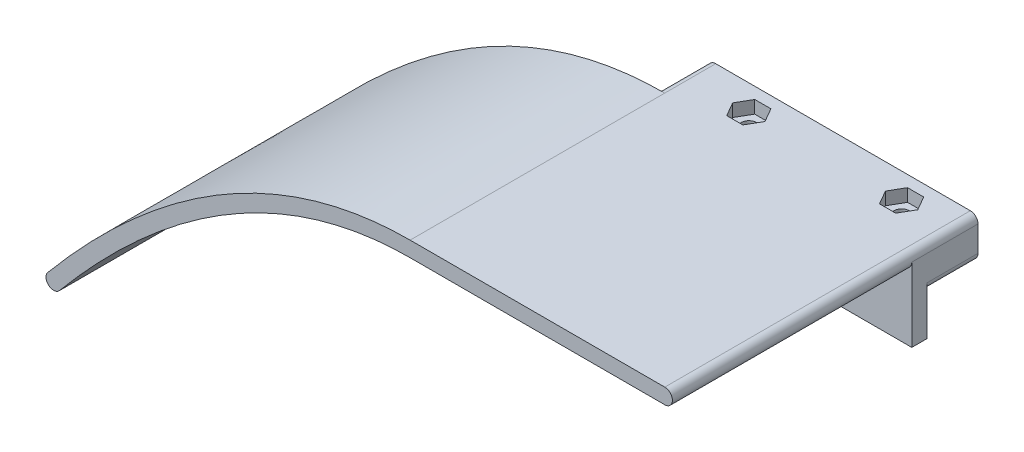
from build123d import *

# Parameters (mm, degrees)
EXTRUDE_1_DEPTH     = 50
EXTRUDE_2_DEPTH     = 3
EXTRUDE_START       = 10
EXTRUDE_3_DEPTH     = 10
SKETCH_4_R          = 1.5
CUT_EXTRUDE_1_DEPTH = 118.080033402
CUT_EXTRUDE_2_DEPTH = 117.530565712
CUT_EXTRUDE_START   = -2.5
CUT_EXTRUDE_3_DEPTH = 120.580033402
FILLET_1_R          = 2


with BuildPart() as part:
    # 草图1 → 凸台-拉伸1 (new body)
    with BuildSketch(Plane.XY):
        with BuildLine():
            Line((-25, -1.5), (25, -1.5))
            ThreePointArc((25, -1.5), (26.5, 0), (25, 1.5))
            Line((25, 1.5), (-25, 1.5))
            add(Edge.make_bspline(
                [(-25, 1.5), (-38.932541092, 1.484861592), (-61.458930533, -8.274990766), (-83.417009709, -24.344980195), (-96.150189782, -39.5743173)],
                knots=[0, 0, 0, 0.375, 0.625, 1, 1, 1], degree=2))
            ThreePointArc((-96.150189782, -39.5743173), (-95.96284135, -41.687348432), (-93.849810218, -41.5))
            add(Edge.make_bspline(
                [(-25, -1.5), (-60.365202195, -1.5), (-93.849810218, -41.5)],
                knots=[0, 0, 0, 1, 1, 1], degree=2))
        make_face()
    extrude(amount=EXTRUDE_1_DEPTH)

    # 草图2 → 凸台-拉伸2 (add)
    with BuildSketch(Plane(origin=(0, 0, 0), x_dir=(-1, 0, 0), z_dir=(0, 0, -1))):
        with BuildLine():
            Line((25, 1.5), (-25, 1.5))
            ThreePointArc((-25, 1.5), (-26.060660172, 1.060660172), (-26.5, 0))
            Line((-26.5, 0), (-26.5, -42.03715865))
            Line((-26.5, -42.03715865), (95, -42.03715865))
            ThreePointArc((95, -42.03715865), (96.359091981, -41.171878263), (96.150189782, -39.5743173))
            add(Edge.make_bspline(
                [(25, 1.5), (38.932541092, 1.484861592), (61.458930533, -8.274990766), (83.417009709, -24.344980195), (96.150189782, -39.5743173)],
                knots=[0, 0, 0, 0.375, 0.625, 1, 1, 1], degree=2))
        make_face()
    extrude(amount=-EXTRUDE_2_DEPTH)

    # 草图3 → 凸台-拉伸3 (add)
    with BuildSketch(Plane(origin=(0, 0, 0), x_dir=(-1, 0, 0), z_dir=(0, 0, -1)).offset(EXTRUDE_START)):
        with BuildLine():
            Line((-25, 1.5), (25, 1.5))
            ThreePointArc((25, 1.5), (26.060660172, 1.060660172), (26.5, 0))
            Line((26.5, 0), (26.5, -5))
            ThreePointArc((26.5, -5), (26.060660172, -6.060660172), (25, -6.5))
            Line((25, -6.5), (-25, -6.5))
            ThreePointArc((-25, -6.5), (-26.060660172, -6.060660172), (-26.5, -5))
            Line((-26.5, -5), (-26.5, 0))
            ThreePointArc((-26.5, 0), (-26.060660172, 1.060660172), (-25, 1.5))
        make_face()
    extrude(amount=-EXTRUDE_3_DEPTH)

    # 草图4 → 切除-拉伸1 (cut, through all)
    with BuildSketch(Plane(origin=(0, 1.5, 0), x_dir=(1, 0, 0), z_dir=(0, 1, 0))):
        with Locations((-13.5, 5)):
            Circle(SKETCH_4_R)
        with Locations((16.5, 5)):
            Circle(SKETCH_4_R)
    extrude(amount=-CUT_EXTRUDE_1_DEPTH, mode=Mode.SUBTRACT)

    # 草图5 → 切除-拉伸2 (cut, through all)
    with BuildSketch(Plane(origin=(0, 0, 0), x_dir=(-1, 0, 0), z_dir=(0, 0, -1))):
        with BuildLine():
            Line((-26.5, -14.5), (33.5, -14.5))
            ThreePointArc((33.5, -14.5), (52.971711616, -22.565447034), (61.03715865, -42.03715865))
            Line((61.03715865, -42.03715865), (-26.5, -42.03715865))
            Line((-26.5, -42.03715865), (-26.5, -14.5))
        make_face()
    extrude(amount=-CUT_EXTRUDE_2_DEPTH, mode=Mode.SUBTRACT)

    # 草图6 → 切除-拉伸3 (cut, through all)
    with BuildSketch(Plane(origin=(0, 1.5, 0), x_dir=(1, 0, 0), z_dir=(0, 1, 0)).offset(CUT_EXTRUDE_START)):
        Polygon((-11.91228676, 7.75), (-15.08771324, 7.75), (-16.675426481, 5), (-15.08771324, 2.25), (-11.91228676, 2.25), (-10.324573519, 5), align=None)
        Polygon((18.08771324, 7.75), (14.91228676, 7.75), (13.324573519, 5), (14.91228676, 2.25), (18.08771324, 2.25), (19.675426481, 5), align=None)
    extrude(amount=CUT_EXTRUDE_3_DEPTH, mode=Mode.SUBTRACT)

    # 圆角1
    fillet_1_edges = [part.edges().sort_by_distance(p)[0] for p in [
        (-61.03715865, -42.03715865, 1.5),
    ]]
    fillet(fillet_1_edges, radius=FILLET_1_R)


solid = part.part
